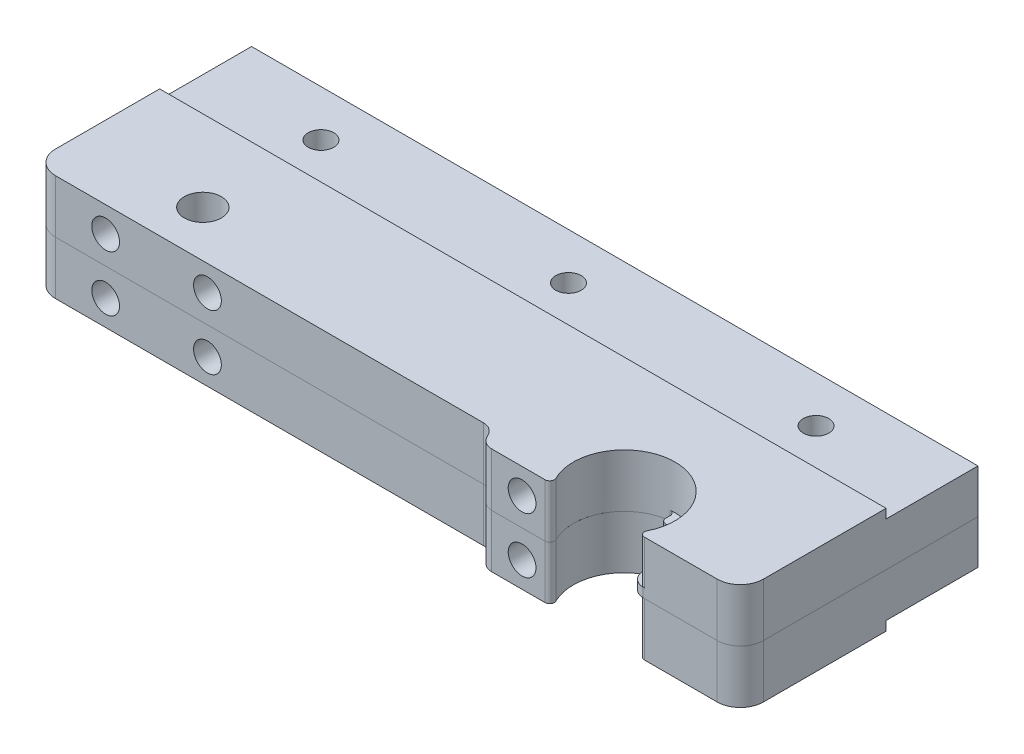
from build123d import *
from build123d.topology import SkipClean

# Parameters (mm, degrees)
SKETCH1_R                = 10
SKETCH1_R_2              = 4
BOSS_EXTRUDE1_DEPTH      = 5.5
BOSS_EXTRUDE2_START      = -9.5
BOSS_EXTRUDE2_OUTLINE_W  = 156.975559889
BOSS_EXTRUDE2_OUTLINE_H  = 70
BOSS_EXTRUDE2_OUTLINE_R  = 4
BOSS_EXTRUDE2_DEPTH      = 9.5
BOSS_EXTRUDE3_START      = -2
BOSS_EXTRUDE3_OUTLINE_W  = 156.975559889
BOSS_EXTRUDE3_OUTLINE_H  = 50.14
BOSS_EXTRUDE3_OUTLINE_R  = 4
BOSS_EXTRUDE3_DEPTH      = 2
SKETCH3_R                = 11
CUT_EXTRUDE1_DEPTH       = 101.911859603
SKETCH10_R               = 2.75
CUT_EXTRUDE43_DEPTH      = 101.703542185
CUT_EXTRUDE48_START      = 10
SKETCH13_W               = 179.362080376
SKETCH13_H               = 98.006622084
CUT_EXTRUDE48_DEPTH      = 30
BOSS_EXTRUDE4_DEPTH      = 11.5
CUT_EXTRUDE42_START      = -4
SKETCH8_R                = 3
SKETCH8_R_2              = 1.4
CUT_EXTRUDE42_DEPTH      = 347.611394255
CUT_EXTRUDE44_DEPTH      = 15
CUT_EXTRUDE44_DEPTH_BACK = 15
SKETCH8_3_R              = 1.4
FILLET2_R                = 3
FILLET3_R                = 1
FILLET4_R                = 5
BOSS_EXTRUDE5_START      = -2
BOSS_EXTRUDE5_DEPTH      = 2
FILLET5_R                = 3
FILLET6_R                = 1


# Read off the part's stored shape, not the designer's step: Boss-Extrude2, Boss-Extrude3
with BuildPart() as part:
    # Sketch1 → Boss-Extrude1 (new body)
    with BuildSketch(Plane(origin=(0, 0, 0), x_dir=(1, 0, 0), z_dir=(0, 1, 0))):
        with Locations(Location((-38.212401265, -7.350001428, 0), (0, 0, 270))):
            Circle(SKETCH1_R)
        with Locations(Location((-38.212401265, -7.350001428, 0), (0, 0, 270))):
            Circle(SKETCH1_R_2, mode=Mode.SUBTRACT)
    extrude(amount=BOSS_EXTRUDE1_DEPTH)

    # Boss-Extrude2 outline → Boss-Extrude2 (add)
    with BuildSketch(Plane.XZ.offset(BOSS_EXTRUDE2_START)):
        with Locations((13.445637236, 4.990001428)):
            Rectangle(BOSS_EXTRUDE2_OUTLINE_W, BOSS_EXTRUDE2_OUTLINE_H)
        with Locations((-38.212401265, 7.350001428)):
            Circle(BOSS_EXTRUDE2_OUTLINE_R, mode=Mode.SUBTRACT)
    extrude(amount=BOSS_EXTRUDE2_DEPTH)

    # Boss-Extrude3 outline → Boss-Extrude3 (add)
    with BuildSketch(Plane.XZ.offset(-9.5).offset(BOSS_EXTRUDE3_START)):
        with Locations((13.445637236, 14.920001428)):
            Rectangle(BOSS_EXTRUDE3_OUTLINE_W, BOSS_EXTRUDE3_OUTLINE_H)
        with Locations((-38.212401265, 7.350001428)):
            Circle(BOSS_EXTRUDE3_OUTLINE_R, mode=Mode.SUBTRACT)
    extrude(amount=BOSS_EXTRUDE3_DEPTH)

    # Sketch3 → Cut-Extrude1 (cut, through all)
    with BuildSketch(Plane(origin=(0, 11.5, 0), x_dir=(1, 0, 0), z_dir=(0, 1, 0))):
        with Locations(Location((60.479718282, -14.990001428, 0), (0, 0, 270))):
            Circle(SKETCH3_R)
    extrude(amount=-CUT_EXTRUDE1_DEPTH, mode=Mode.SUBTRACT)

    # Sketch10 → Cut-Extrude43 (cut, through all)
    with BuildSketch(Plane(origin=(0, 9.5, 0), x_dir=(1, 0, 0), z_dir=(0, 1, 0))):
        with Locations(Location((66.93341718, 20.009998572, 0), (0, 0, 270))):
            Circle(SKETCH10_R)
        with Locations(Location((-40.042142709, 20.009998572, 0), (0, 0, 270))):
            Circle(SKETCH10_R)
        with Locations(Location((13.445637235, 20.009998572, 0), (0, 0, 270))):
            Circle(SKETCH10_R)
    extrude(amount=-CUT_EXTRUDE43_DEPTH, mode=Mode.SUBTRACT)

    # Sketch13 → Cut-Extrude48 (cut)
    with BuildSketch(Plane.XY.offset(7.350001428).offset(CUT_EXTRUDE48_START)):
        with Locations((17.955760485, -15.688862508)):
            Rectangle(SKETCH13_W, SKETCH13_H)
    extrude(amount=CUT_EXTRUDE48_DEPTH, mode=Mode.SUBTRACT)

    # Sketch16 → Boss-Extrude4 (add)
    with SkipClean():  # the faces are left unmerged after this step: merging them gives an invalid solid
        with BuildSketch(Plane(origin=(0, 11.5, 0), x_dir=(1, 0, 0), z_dir=(0, 1, 0))):
            with BuildLine():
                Line((34.170317205, -17.350001428), (36.479718282, -21.350001428))
                Line((36.479718282, -21.350001428), (51.504730817, -21.350001428))
                ThreePointArc((51.504730817, -21.350001428), (50.419490762, -19.43880152), (49.735864225, -17.350001428))
                Line((49.735864225, -17.350001428), (34.170317205, -17.350001428))
            make_face()
            with BuildLine():
                ThreePointArc((71.223572339, -17.350001428), (70.539945801, -19.43880152), (69.454705747, -21.350001428))
                Line((69.454705747, -21.350001428), (91.93341718, -21.350001428))
                Line((91.93341718, -21.350001428), (91.93341718, -17.350001428))
                Line((91.93341718, -17.350001428), (71.223572339, -17.350001428))
            make_face()
        extrude(amount=-BOSS_EXTRUDE4_DEPTH)

    # Sketch8 → Cut-Extrude42 (cut, through all)
    # profile 1 of 3: a face of its own
    with SkipClean():  # the faces are left unmerged after this step: merging them gives an invalid solid
        with BuildSketch(Plane(origin=(283.383358914, 0, 7.350001428), x_dir=(-1, 0, 0), z_dir=(0, 0, -1)).offset(CUT_EXTRUDE42_START)):
            with Locations(Location((310.595760179, 6, 0), (0, 0, 180))):
                Circle(SKETCH8_R)
            with Locations(Location((310.595760179, 6, 0), (0, 0, 180))):
                Circle(SKETCH8_R_2, mode=Mode.SUBTRACT)
        # profile 2 of 3: a face of its own
        with BuildSketch(Plane(origin=(283.383358914, 0, 7.350001428), x_dir=(-1, 0, 0), z_dir=(0, 0, -1)).offset(CUT_EXTRUDE42_START)):
            with Locations(Location((238.608366736, 6, 0), (0, 0, 180))):
                Circle(SKETCH8_R)
            with Locations(Location((238.608366736, 6, 0), (0, 0, 180))):
                Circle(SKETCH8_R_2, mode=Mode.SUBTRACT)
        # profile 3 of 3: a face of its own
        with BuildSketch(Plane(origin=(283.383358914, 0, 7.350001428), x_dir=(-1, 0, 0), z_dir=(0, 0, -1)).offset(CUT_EXTRUDE42_START)):
            with Locations(Location((332.595760179, 6, 0), (0, 0, 180))):
                Circle(SKETCH8_R)
            with Locations(Location((332.595760179, 6, 0), (0, 0, 180))):
                Circle(SKETCH8_R_2, mode=Mode.SUBTRACT)
        extrude(amount=-CUT_EXTRUDE42_DEPTH, mode=Mode.SUBTRACT)

    # Sketch8<3> → Cut-Extrude44 (cut, two sides: drawn at the far end of the back side and taken through both)
    with SkipClean():  # the faces are left unmerged after this step: merging them gives an invalid solid
        with BuildSketch(Plane(origin=(283.383358914, 0, 7.350001428), x_dir=(-1, 0, 0), z_dir=(0, 0, -1)).offset(-CUT_EXTRUDE44_DEPTH_BACK)):
            with Locations(Location((332.595760179, 6, 0), (0, 0, 180))):
                Circle(SKETCH8_3_R)
            with Locations(Location((310.595760179, 6, 0), (0, 0, 180))):
                Circle(SKETCH8_3_R)
            with Locations((238.608366736, 6)):
                Circle(SKETCH8_3_R)
        extrude(amount=CUT_EXTRUDE44_DEPTH + CUT_EXTRUDE44_DEPTH_BACK, mode=Mode.SUBTRACT)

    # Fillet2
    fillet2_edges = [part.edges().sort_by_distance(p)[0] for p in [
        (34.170317205, 5.75, 17.350001428),
        (36.479718282, 5.75, 21.350001428),
    ]]
    fillet(fillet2_edges, radius=FILLET2_R)

    # Fillet3
    fillet3_edges = [part.edges().sort_by_distance(p)[0] for p in [
        (51.504730817, 5.75, 21.350001428),
        (69.454705747, 5.75, 21.350001428),
    ]]
    fillet(fillet3_edges, radius=FILLET3_R)

    # Fillet4
    # the kernel refuses this fillet: 5 mm, written as the material it takes off along each edge
    with BuildSketch(Plane(origin=(-65.042142709, -12.5, 17.350001428), x_dir=(1, 0, 0), z_dir=(0, 1, 0))) as fillet4_piece_1:
        with BuildLine():
            CenterArc((FILLET4_R, FILLET4_R), FILLET4_R, 180, 90)
            Line((0, FILLET4_R), (0, 0))
            Line((0, 0), (FILLET4_R, 0))
        make_face()
    extrude(amount=36.5, mode=Mode.SUBTRACT)
    with BuildSketch(Plane(origin=(91.93341718, 24, 21.350001428), x_dir=(0, 0, -1), z_dir=(0, -1, 0))) as fillet4_piece_2:
        with BuildLine():
            CenterArc((FILLET4_R, -FILLET4_R), FILLET4_R, 90, 90)
            Line((0, -FILLET4_R), (0, 0))
            Line((0, 0), (FILLET4_R, 0))
        make_face()
    extrude(amount=36.5, mode=Mode.SUBTRACT)


with BuildPart() as body_2:
    # Mirror1: mirrored copy
    add(part.part.mirror(Plane.ZX))


with BuildPart() as part_1:
    add(part.part)

    # Sketch17 → Boss-Extrude5 (add)
    with BuildSketch(Plane.XZ.offset(BOSS_EXTRUDE5_START)):
        with BuildLine():
            ThreePointArc((65.332593718, 21.350001428), (68.05863641, 12.428751733), (60.479718282, 6.990001428))
            Line((60.479718282, 6.990001428), (60.479718282, 3.990001428))
            ThreePointArc((60.479718282, 3.990001428), (68.257892875, 7.211826835), (71.479718282, 14.990001428))
            Line((71.479718282, 14.990001428), (71.441992674, 15.900243231))
            ThreePointArc((71.441992674, 15.900243231), (71.072525944, 17.955203923), (70.321423193, 19.903334762))
            ThreePointArc((70.321423193, 19.903334762), (70.365633584, 20.875992556), (71.216123639, 21.350001428))
            Line((71.216123639, 21.350001428), (65.332593718, 21.350001428))
        make_face()
    extrude(amount=BOSS_EXTRUDE5_DEPTH)

    # Fillet5
    fillet5_edges = [part_1.edges().sort_by_distance(p)[0] for p in [
        (65.332593718, 1, 21.350001428),
    ]]
    fillet(fillet5_edges, radius=FILLET5_R)

    # Fillet6
    fillet6_edges = [part_1.edges().sort_by_distance(p)[0] for p in [
        (60.479718282, 1, 6.990001428),
        (60.479718282, 1, 3.990001428),
    ]]
    fillet(fillet6_edges, radius=FILLET6_R)


solid = Compound([body_2.part, part_1.part])
